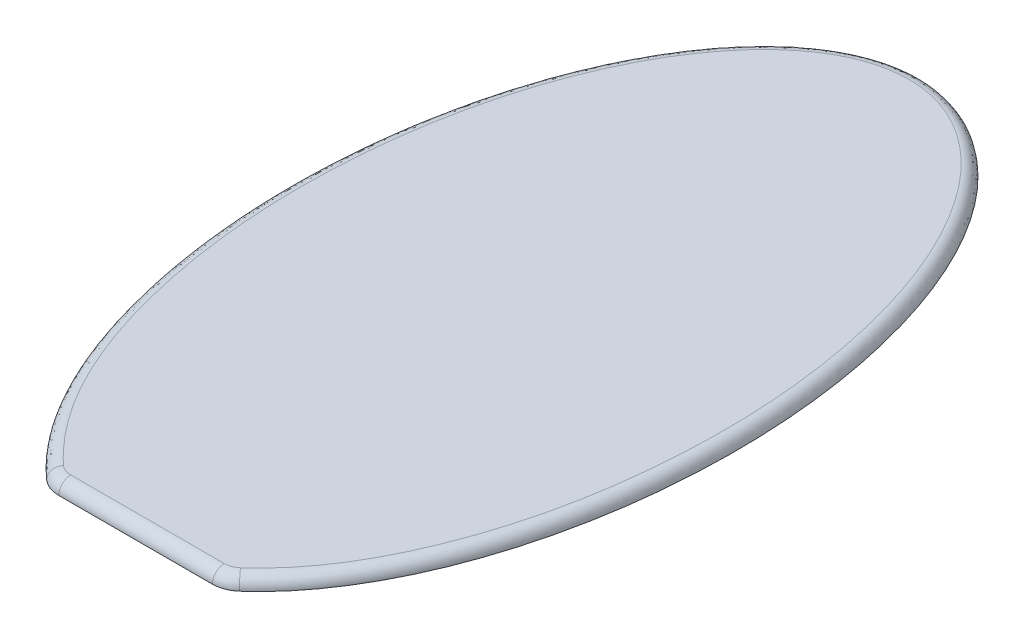
from build123d import *

# Parameters (mm, degrees)
SKETCH1_RX          = 34.925
SKETCH1_RY          = 19.05
BOSS_EXTRUDE1_DEPTH = 1.016
CUT_EXTRUDE1_DEPTH  = 40.795607559
FILLET1_R           = 2.54
FILLET2_R           = 1.016


with BuildPart() as part:
    # Sketch1 → Boss-Extrude1 (new body)
    with BuildSketch(Plane(origin=(0, 0, 0), x_dir=(1, 0, 0), z_dir=(0, 1, 0))):
        with Locations(Location((0, 0), (0, 0, -90))):
            Ellipse(SKETCH1_RX, SKETCH1_RY)
    extrude(amount=BOSS_EXTRUDE1_DEPTH)

    # Sketch2 → Cut-Extrude1 (cut, through all)
    with BuildSketch(Plane(origin=(0, 1.016, 0), x_dir=(1, 0, 0), z_dir=(0, 1, 0))):
        with BuildLine():
            Line((-7.466044736, -32.131), (7.466044736, -32.131))
            add(Edge.make_bspline(
                [(-7.466044736, -32.131), (0, -37.961956522), (7.466044736, -32.131)],
                knots=[5.880469466, 5.880469466, 5.880469466, 6.685901149, 6.685901149, 6.685901149], degree=2, weights=[1, 0.92, 1]))
        make_face()
    extrude(amount=-CUT_EXTRUDE1_DEPTH, mode=Mode.SUBTRACT)

    # Fillet1
    fillet1_edges = [part.edges().sort_by_distance(p)[0] for p in [
        (-7.466044736, 0.508, 32.131),
        (7.466044736, 0.508, 32.131),
    ]]
    fillet(fillet1_edges, radius=FILLET1_R)

    # Fillet2
    fillet2_edges = [part.edges().sort_by_distance(p)[0] for p in [
        (7.44707344, 1.016, 31.967969469),
        (-7.44707344, 1.016, 31.967969469),
        (0, 1.016, 32.131),
        (0, 1.016, -34.925),
    ]]
    fillet(fillet2_edges, radius=FILLET2_R - 0.0004)  # a hair under: the kernel refuses the full size


solid = part.part
